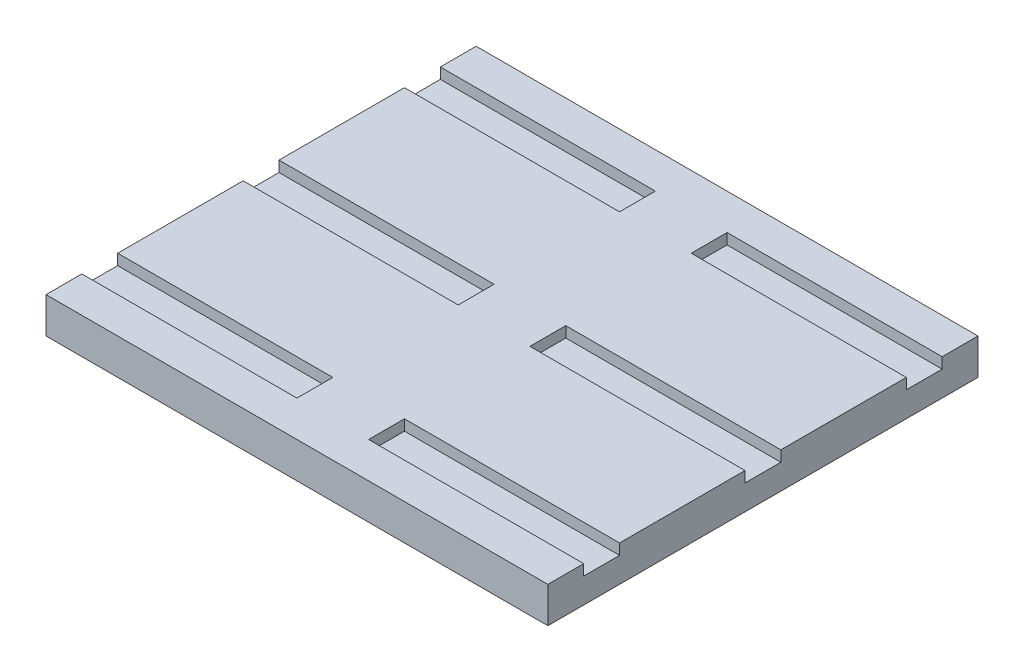
from build123d import *

# Parameters (mm, degrees)
SKETCH2_W               = 177.8
SKETCH2_H               = 152.4
BOSS_EXTRUDE1_DEPTH     = 12.7
SKETCH4_W               = 12.7
SKETCH4_H               = 3.81
CUT_EXTRUDE1_DEPTH      = 76.2
SKETCH5_W               = 12.7
SKETCH5_H               = 3.81
CUT_EXTRUDE2_DEPTH      = 76.2
MIRROR3_COPY_1_SKETCH_W = 12.7
MIRROR3_COPY_1_SKETCH_H = 3.81
MIRROR3_COPY_1_DEPTH    = 76.2


with BuildPart() as part:
    # Sketch2 → Boss-Extrude1 (new body)
    with BuildSketch(Plane(origin=(0, 0, 0), x_dir=(1, 0, 0), z_dir=(0, 1, 0))):
        Rectangle(SKETCH2_W, SKETCH2_H)
    extrude(amount=BOSS_EXTRUDE1_DEPTH)

    # Sketch4 → Cut-Extrude1 (cut)
    with BuildSketch(Plane(origin=(88.9, 0, 0), x_dir=(0, 0, -1), z_dir=(1, 0, 0))):
        with Locations((-57.15, 10.795)):
            Rectangle(SKETCH4_W, SKETCH4_H)
    cut_extrude1 = extrude(amount=-CUT_EXTRUDE1_DEPTH, mode=Mode.SUBTRACT)

    # Mirror1: Cut-Extrude1 across plane
    add(cut_extrude1.mirror(Plane.XY), mode=Mode.SUBTRACT)

    # Sketch5 → Cut-Extrude2 (cut)
    with BuildSketch(Plane(origin=(88.9, 0, 0), x_dir=(0, 0, -1), z_dir=(1, 0, 0))):
        with Locations((0, 10.795)):
            Rectangle(SKETCH5_W, SKETCH5_H)
    cut_extrude2 = extrude(amount=-CUT_EXTRUDE2_DEPTH, mode=Mode.SUBTRACT)

    # Mirror3: Cut-Extrude1, Cut-Extrude2 across plane
    add(cut_extrude1.mirror(Plane(origin=(0, 0, 0), x_dir=(0, 0, 1), z_dir=(1, 0, 0))), mode=Mode.SUBTRACT)
    add(cut_extrude2.mirror(Plane(origin=(0, 0, 0), x_dir=(0, 0, 1), z_dir=(1, 0, 0))), mode=Mode.SUBTRACT)

    # Mirror3 copy 1 sketch → Mirror3 copy 1 (cut)
    with BuildSketch(Plane.ZY.offset(88.9)):
        with Locations((-57.15, 10.795)):
            Rectangle(MIRROR3_COPY_1_SKETCH_W, MIRROR3_COPY_1_SKETCH_H)
    extrude(amount=-MIRROR3_COPY_1_DEPTH, mode=Mode.SUBTRACT)


solid = part.part
